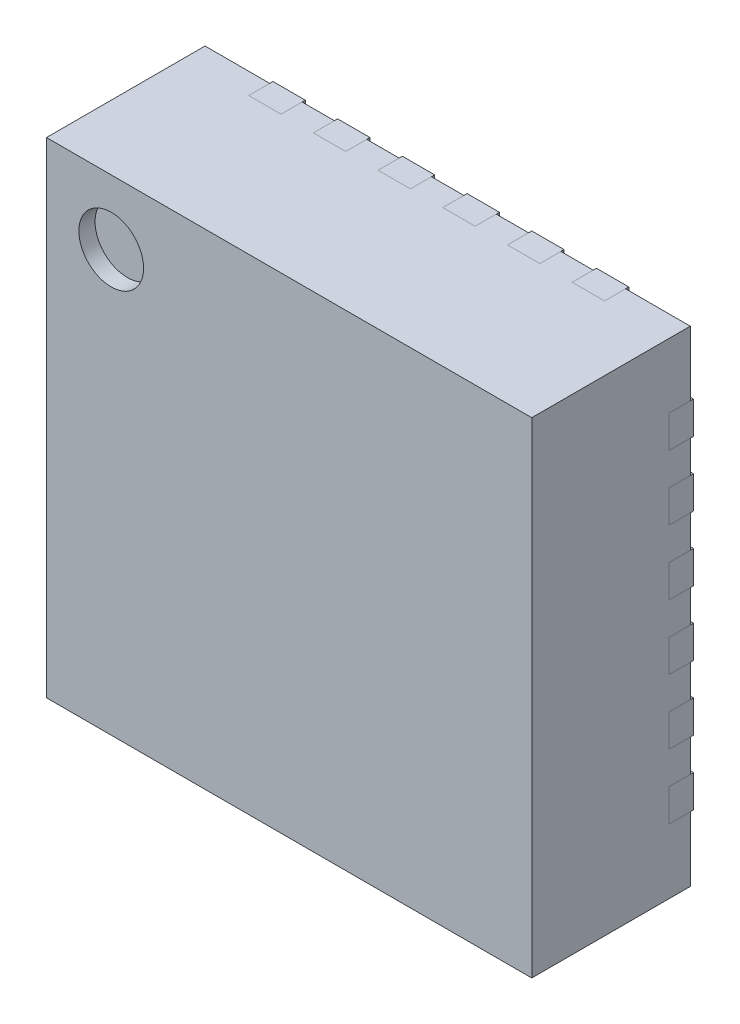
from build123d import *

# Parameters (mm, degrees)
ESQUISSE1_W                = 3
ESQUISSE1_H                = 3
BOSS_EXTRU_1_DEPTH         = 0.98
ENL_V_MAT_EXTRU_3_DEPTH    = 0.13
BOSS_EXTRU_3_DEPTH         = 0.13
BOSS_EXTRU_3_DEPTH_BACK    = 0.02
BOSS_EXTRU_3_2_DEPTH       = 0.13
BOSS_EXTRU_3_2_DEPTH_BACK  = 0.02
BOSS_EXTRU_3_3_DEPTH       = 0.13
BOSS_EXTRU_3_3_DEPTH_BACK  = 0.02
BOSS_EXTRU_3_4_DEPTH       = 0.13
BOSS_EXTRU_3_4_DEPTH_BACK  = 0.02
BOSS_EXTRU_3_5_DEPTH       = 0.13
BOSS_EXTRU_3_5_DEPTH_BACK  = 0.02
BOSS_EXTRU_3_6_DEPTH       = 0.13
BOSS_EXTRU_3_6_DEPTH_BACK  = 0.02
BOSS_EXTRU_3_7_DEPTH       = 0.13
BOSS_EXTRU_3_7_DEPTH_BACK  = 0.02
BOSS_EXTRU_3_8_DEPTH       = 0.13
BOSS_EXTRU_3_8_DEPTH_BACK  = 0.02
BOSS_EXTRU_3_9_DEPTH       = 0.13
BOSS_EXTRU_3_9_DEPTH_BACK  = 0.02
BOSS_EXTRU_3_10_DEPTH      = 0.13
BOSS_EXTRU_3_10_DEPTH_BACK = 0.02
BOSS_EXTRU_3_11_DEPTH      = 0.13
BOSS_EXTRU_3_11_DEPTH_BACK = 0.02
BOSS_EXTRU_3_12_DEPTH      = 0.13
BOSS_EXTRU_3_12_DEPTH_BACK = 0.02
BOSS_EXTRU_3_13_DEPTH      = 0.13
BOSS_EXTRU_3_13_DEPTH_BACK = 0.02
BOSS_EXTRU_3_14_DEPTH      = 0.13
BOSS_EXTRU_3_14_DEPTH_BACK = 0.02
BOSS_EXTRU_3_15_DEPTH      = 0.13
BOSS_EXTRU_3_15_DEPTH_BACK = 0.02
BOSS_EXTRU_3_16_DEPTH      = 0.13
BOSS_EXTRU_3_16_DEPTH_BACK = 0.02
BOSS_EXTRU_3_17_DEPTH      = 0.13
BOSS_EXTRU_3_17_DEPTH_BACK = 0.02
BOSS_EXTRU_3_18_DEPTH      = 0.13
BOSS_EXTRU_3_18_DEPTH_BACK = 0.02
BOSS_EXTRU_3_19_DEPTH      = 0.13
BOSS_EXTRU_3_19_DEPTH_BACK = 0.02
BOSS_EXTRU_3_20_DEPTH      = 0.13
BOSS_EXTRU_3_20_DEPTH_BACK = 0.02
BOSS_EXTRU_3_21_DEPTH      = 0.13
BOSS_EXTRU_3_21_DEPTH_BACK = 0.02
BOSS_EXTRU_3_22_DEPTH      = 0.13
BOSS_EXTRU_3_22_DEPTH_BACK = 0.02
BOSS_EXTRU_3_23_DEPTH      = 0.13
BOSS_EXTRU_3_23_DEPTH_BACK = 0.02
BOSS_EXTRU_3_24_DEPTH      = 0.13
BOSS_EXTRU_3_24_DEPTH_BACK = 0.02
BOSS_EXTRU_3_25_DEPTH      = 0.13
BOSS_EXTRU_3_25_DEPTH_BACK = 0.02
ESQUISSE5_R                = 0.2
ENL_V_MAT_EXTRU_4_DEPTH    = 0.1


with BuildPart() as part:
    # Esquisse1 → Boss.-Extru.1 (new body)
    with BuildSketch(Plane.XY):
        Rectangle(ESQUISSE1_W, ESQUISSE1_H)
    extrude(amount=BOSS_EXTRU_1_DEPTH)

    # Esquisse3 → Enlèv. mat.-Extru.3 (cut)
    with BuildSketch(Plane.XY):
        with BuildLine():
            Line((-1.275, -0.5), (-1.5, -0.5))
            Line((-1.5, -0.5), (-1.5, -0.7))
            Line((-1.5, -0.7), (-1.275, -0.7))
            ThreePointArc((-1.275, -0.7), (-1.221966991, -0.678033009), (-1.2, -0.625))
            Line((-1.2, -0.625), (-1.2, -0.575))
            ThreePointArc((-1.2, -0.575), (-1.221966991, -0.521966991), (-1.275, -0.5))
        make_face()
        with BuildLine():
            Line((0.85, 0.62), (0.85, -0.62))
            ThreePointArc((0.85, -0.62), (0.806066017, -0.726066017), (0.7, -0.77))
            Line((0.7, -0.77), (-0.7, -0.77))
            ThreePointArc((-0.7, -0.77), (-0.806066017, -0.726066017), (-0.85, -0.62))
            Line((-0.85, -0.62), (-0.85, 0.52))
            Line((-0.85, 0.52), (-0.6, 0.77))
            Line((-0.6, 0.77), (0.7, 0.77))
            ThreePointArc((0.7, 0.77), (0.806066017, 0.726066017), (0.85, 0.62))
        make_face()
        with BuildLine():
            Line((-1.5, 1.1), (-1.28, 1.1))
            ThreePointArc((-1.28, 1.1), (-1.220323996, 1.053117336), (-1.2, 0.98))
            ThreePointArc((-1.2, 0.98), (-1.223431458, 0.923431458), (-1.28, 0.9))
            Line((-1.28, 0.9), (-1.5, 0.9))
            Line((-1.5, 0.9), (-1.5, 1.1))
        make_face()
        with BuildLine():
            Line((-1.5, -0.1), (-1.5, -0.3))
            Line((-1.5, -0.3), (-1.275, -0.3))
            ThreePointArc((-1.275, -0.3), (-1.221966991, -0.278033009), (-1.2, -0.225))
            Line((-1.2, -0.225), (-1.2, -0.175))
            ThreePointArc((-1.2, -0.175), (-1.221966991, -0.121966991), (-1.275, -0.1))
            Line((-1.275, -0.1), (-1.5, -0.1))
        make_face()
        with BuildLine():
            Line((-1.5, 0.3), (-1.5, 0.1))
            Line((-1.5, 0.1), (-1.275, 0.1))
            ThreePointArc((-1.275, 0.1), (-1.221966991, 0.121966991), (-1.2, 0.175))
            Line((-1.2, 0.175), (-1.2, 0.225))
            ThreePointArc((-1.2, 0.225), (-1.221966991, 0.278033009), (-1.275, 0.3))
            Line((-1.275, 0.3), (-1.5, 0.3))
        make_face()
        with BuildLine():
            Line((-1.5, 0.7), (-1.5, 0.5))
            Line((-1.5, 0.5), (-1.275, 0.5))
            ThreePointArc((-1.275, 0.5), (-1.221966991, 0.521966991), (-1.2, 0.575))
            Line((-1.2, 0.575), (-1.2, 0.625))
            ThreePointArc((-1.2, 0.625), (-1.221966991, 0.678033009), (-1.275, 0.7))
            Line((-1.275, 0.7), (-1.5, 0.7))
        make_face()
        with BuildLine():
            Line((-1.5, -0.9), (-1.5, -1.1))
            Line((-1.5, -1.1), (-1.28, -1.1))
            ThreePointArc((-1.28, -1.1), (-1.220323996, -1.053117336), (-1.2, -0.98))
            ThreePointArc((-1.2, -0.98), (-1.223431458, -0.923431458), (-1.28, -0.9))
            Line((-1.28, -0.9), (-1.5, -0.9))
        make_face()
        with BuildLine():
            Line((1.1, 1.5), (1.1, 1.28))
            ThreePointArc((1.1, 1.28), (1.053117336, 1.220323996), (0.98, 1.2))
            ThreePointArc((0.98, 1.2), (0.923431458, 1.223431458), (0.9, 1.28))
            Line((0.9, 1.28), (0.9, 1.5))
            Line((0.9, 1.5), (1.1, 1.5))
        make_face()
        with BuildLine():
            Line((0.7, 1.5), (0.5, 1.5))
            Line((0.5, 1.5), (0.5, 1.275))
            ThreePointArc((0.5, 1.275), (0.521966991, 1.221966991), (0.575, 1.2))
            Line((0.575, 1.2), (0.625, 1.2))
            ThreePointArc((0.625, 1.2), (0.678033009, 1.221966991), (0.7, 1.275))
            Line((0.7, 1.275), (0.7, 1.5))
        make_face()
        with BuildLine():
            Line((0.3, 1.5), (0.1, 1.5))
            Line((0.1, 1.5), (0.1, 1.275))
            ThreePointArc((0.1, 1.275), (0.121966991, 1.221966991), (0.175, 1.2))
            Line((0.175, 1.2), (0.225, 1.2))
            ThreePointArc((0.225, 1.2), (0.278033009, 1.221966991), (0.3, 1.275))
            Line((0.3, 1.275), (0.3, 1.5))
        make_face()
        with BuildLine():
            Line((-0.1, 1.5), (-0.3, 1.5))
            Line((-0.3, 1.5), (-0.3, 1.275))
            ThreePointArc((-0.3, 1.275), (-0.278033009, 1.221966991), (-0.225, 1.2))
            Line((-0.225, 1.2), (-0.175, 1.2))
            ThreePointArc((-0.175, 1.2), (-0.121966991, 1.221966991), (-0.1, 1.275))
            Line((-0.1, 1.275), (-0.1, 1.5))
        make_face()
        with BuildLine():
            Line((1.5, -1.1), (1.28, -1.1))
            ThreePointArc((1.28, -1.1), (1.220323996, -1.053117336), (1.2, -0.98))
            ThreePointArc((1.2, -0.98), (1.223431458, -0.923431458), (1.28, -0.9))
            Line((1.28, -0.9), (1.5, -0.9))
            Line((1.5, -0.9), (1.5, -1.1))
        make_face()
        with BuildLine():
            Line((1.5, -0.7), (1.5, -0.5))
            Line((1.5, -0.5), (1.275, -0.5))
            ThreePointArc((1.275, -0.5), (1.221966991, -0.521966991), (1.2, -0.575))
            Line((1.2, -0.575), (1.2, -0.625))
            ThreePointArc((1.2, -0.625), (1.221966991, -0.678033009), (1.275, -0.7))
            Line((1.275, -0.7), (1.5, -0.7))
        make_face()
        with BuildLine():
            Line((1.5, -0.3), (1.5, -0.1))
            Line((1.5, -0.1), (1.275, -0.1))
            ThreePointArc((1.275, -0.1), (1.221966991, -0.121966991), (1.2, -0.175))
            Line((1.2, -0.175), (1.2, -0.225))
            ThreePointArc((1.2, -0.225), (1.221966991, -0.278033009), (1.275, -0.3))
            Line((1.275, -0.3), (1.5, -0.3))
        make_face()
        with BuildLine():
            Line((1.5, 0.1), (1.5, 0.3))
            Line((1.5, 0.3), (1.275, 0.3))
            ThreePointArc((1.275, 0.3), (1.221966991, 0.278033009), (1.2, 0.225))
            Line((1.2, 0.225), (1.2, 0.175))
            ThreePointArc((1.2, 0.175), (1.221966991, 0.121966991), (1.275, 0.1))
            Line((1.275, 0.1), (1.5, 0.1))
        make_face()
        with BuildLine():
            Line((-1.1, -1.5), (-1.1, -1.28))
            ThreePointArc((-1.1, -1.28), (-1.053117336, -1.220323996), (-0.98, -1.2))
            ThreePointArc((-0.98, -1.2), (-0.923431458, -1.223431458), (-0.9, -1.28))
            Line((-0.9, -1.28), (-0.9, -1.5))
            Line((-0.9, -1.5), (-1.1, -1.5))
        make_face()
        with BuildLine():
            Line((-0.7, -1.5), (-0.5, -1.5))
            Line((-0.5, -1.5), (-0.5, -1.275))
            ThreePointArc((-0.5, -1.275), (-0.521966991, -1.221966991), (-0.575, -1.2))
            Line((-0.575, -1.2), (-0.625, -1.2))
            ThreePointArc((-0.625, -1.2), (-0.678033009, -1.221966991), (-0.7, -1.275))
            Line((-0.7, -1.275), (-0.7, -1.5))
        make_face()
        with BuildLine():
            Line((-0.3, -1.5), (-0.1, -1.5))
            Line((-0.1, -1.5), (-0.1, -1.275))
            ThreePointArc((-0.1, -1.275), (-0.121966991, -1.221966991), (-0.175, -1.2))
            Line((-0.175, -1.2), (-0.225, -1.2))
            ThreePointArc((-0.225, -1.2), (-0.278033009, -1.221966991), (-0.3, -1.275))
            Line((-0.3, -1.275), (-0.3, -1.5))
        make_face()
        with BuildLine():
            Line((0.1, -1.5), (0.3, -1.5))
            Line((0.3, -1.5), (0.3, -1.275))
            ThreePointArc((0.3, -1.275), (0.278033009, -1.221966991), (0.225, -1.2))
            Line((0.225, -1.2), (0.175, -1.2))
            ThreePointArc((0.175, -1.2), (0.121966991, -1.221966991), (0.1, -1.275))
            Line((0.1, -1.275), (0.1, -1.5))
        make_face()
        with BuildLine():
            Line((-0.5, 1.5), (-0.7, 1.5))
            Line((-0.7, 1.5), (-0.7, 1.275))
            ThreePointArc((-0.7, 1.275), (-0.678033009, 1.221966991), (-0.625, 1.2))
            Line((-0.625, 1.2), (-0.575, 1.2))
            ThreePointArc((-0.575, 1.2), (-0.521966991, 1.221966991), (-0.5, 1.275))
            Line((-0.5, 1.275), (-0.5, 1.5))
        make_face()
        with BuildLine():
            Line((-0.9, 1.5), (-1.1, 1.5))
            Line((-1.1, 1.5), (-1.1, 1.28))
            ThreePointArc((-1.1, 1.28), (-1.053117336, 1.220323996), (-0.98, 1.2))
            ThreePointArc((-0.98, 1.2), (-0.923431458, 1.223431458), (-0.9, 1.28))
            Line((-0.9, 1.28), (-0.9, 1.5))
        make_face()
        with BuildLine():
            Line((1.5, 0.5), (1.5, 0.7))
            Line((1.5, 0.7), (1.275, 0.7))
            ThreePointArc((1.275, 0.7), (1.221966991, 0.678033009), (1.2, 0.625))
            Line((1.2, 0.625), (1.2, 0.575))
            ThreePointArc((1.2, 0.575), (1.221966991, 0.521966991), (1.275, 0.5))
            Line((1.275, 0.5), (1.5, 0.5))
        make_face()
        with BuildLine():
            Line((1.5, 0.9), (1.5, 1.1))
            Line((1.5, 1.1), (1.28, 1.1))
            ThreePointArc((1.28, 1.1), (1.220323996, 1.053117336), (1.2, 0.98))
            ThreePointArc((1.2, 0.98), (1.223431458, 0.923431458), (1.28, 0.9))
            Line((1.28, 0.9), (1.5, 0.9))
        make_face()
        with BuildLine():
            Line((0.5, -1.5), (0.7, -1.5))
            Line((0.7, -1.5), (0.7, -1.275))
            ThreePointArc((0.7, -1.275), (0.678033009, -1.221966991), (0.625, -1.2))
            Line((0.625, -1.2), (0.575, -1.2))
            ThreePointArc((0.575, -1.2), (0.521966991, -1.221966991), (0.5, -1.275))
            Line((0.5, -1.275), (0.5, -1.5))
        make_face()
        with BuildLine():
            Line((0.9, -1.5), (1.1, -1.5))
            Line((1.1, -1.5), (1.1, -1.28))
            ThreePointArc((1.1, -1.28), (1.053117336, -1.220323996), (0.98, -1.2))
            ThreePointArc((0.98, -1.2), (0.923431458, -1.223431458), (0.9, -1.28))
            Line((0.9, -1.28), (0.9, -1.5))
        make_face()
    extrude(amount=ENL_V_MAT_EXTRU_3_DEPTH, mode=Mode.SUBTRACT)

    # Esquisse5 → Enlèv. mat.-Extru.4 (cut)
    with BuildSketch(Plane.XY.offset(0.98)):
        with Locations((-1.1, 1.1)):
            Circle(ESQUISSE5_R)
    extrude(amount=-ENL_V_MAT_EXTRU_4_DEPTH, mode=Mode.SUBTRACT)


with BuildPart() as body_2:
    # Esquisse4 → Boss.-Extru.3 (new, two sides: drawn at the far end of the back side and taken through both)
    with BuildSketch(Plane.XY.offset(-BOSS_EXTRU_3_DEPTH_BACK)):
        with BuildLine():
            Line((-1.275, -0.5), (-1.5, -0.5))
            Line((-1.5, -0.5), (-1.5, -0.7))
            Line((-1.5, -0.7), (-1.275, -0.7))
            ThreePointArc((-1.275, -0.7), (-1.221966991, -0.678033009), (-1.2, -0.625))
            Line((-1.2, -0.625), (-1.2, -0.575))
            ThreePointArc((-1.2, -0.575), (-1.221966991, -0.521966991), (-1.275, -0.5))
        make_face()
    extrude(amount=BOSS_EXTRU_3_DEPTH + BOSS_EXTRU_3_DEPTH_BACK)


with BuildPart() as body_3:
    # Esquisse4 → Boss.-Extru.3 2 (new, two sides: drawn at the far end of the back side and taken through both)
    with BuildSketch(Plane.XY.offset(-BOSS_EXTRU_3_2_DEPTH_BACK)):
        with BuildLine():
            Line((0.85, 0.62), (0.85, -0.62))
            ThreePointArc((0.85, -0.62), (0.806066017, -0.726066017), (0.7, -0.77))
            Line((0.7, -0.77), (-0.7, -0.77))
            ThreePointArc((-0.7, -0.77), (-0.806066017, -0.726066017), (-0.85, -0.62))
            Line((-0.85, -0.62), (-0.85, 0.52))
            Line((-0.85, 0.52), (-0.6, 0.77))
            Line((-0.6, 0.77), (0.7, 0.77))
            ThreePointArc((0.7, 0.77), (0.806066017, 0.726066017), (0.85, 0.62))
        make_face()
    extrude(amount=BOSS_EXTRU_3_2_DEPTH + BOSS_EXTRU_3_2_DEPTH_BACK)


with BuildPart() as body_4:
    # Esquisse4 → Boss.-Extru.3 3 (new, two sides: drawn at the far end of the back side and taken through both)
    with BuildSketch(Plane.XY.offset(-BOSS_EXTRU_3_3_DEPTH_BACK)):
        with BuildLine():
            Line((-1.5, 1.1), (-1.28, 1.1))
            ThreePointArc((-1.28, 1.1), (-1.220323996, 1.053117336), (-1.2, 0.98))
            ThreePointArc((-1.2, 0.98), (-1.223431458, 0.923431458), (-1.28, 0.9))
            Line((-1.28, 0.9), (-1.5, 0.9))
            Line((-1.5, 0.9), (-1.5, 1.1))
        make_face()
    extrude(amount=BOSS_EXTRU_3_3_DEPTH + BOSS_EXTRU_3_3_DEPTH_BACK)


with BuildPart() as body_5:
    # Esquisse4 → Boss.-Extru.3 4 (new, two sides: drawn at the far end of the back side and taken through both)
    with BuildSketch(Plane.XY.offset(-BOSS_EXTRU_3_4_DEPTH_BACK)):
        with BuildLine():
            Line((-1.5, -0.1), (-1.5, -0.3))
            Line((-1.5, -0.3), (-1.275, -0.3))
            ThreePointArc((-1.275, -0.3), (-1.221966991, -0.278033009), (-1.2, -0.225))
            Line((-1.2, -0.225), (-1.2, -0.175))
            ThreePointArc((-1.2, -0.175), (-1.221966991, -0.121966991), (-1.275, -0.1))
            Line((-1.275, -0.1), (-1.5, -0.1))
        make_face()
    extrude(amount=BOSS_EXTRU_3_4_DEPTH + BOSS_EXTRU_3_4_DEPTH_BACK)


with BuildPart() as body_6:
    # Esquisse4 → Boss.-Extru.3 5 (new, two sides: drawn at the far end of the back side and taken through both)
    with BuildSketch(Plane.XY.offset(-BOSS_EXTRU_3_5_DEPTH_BACK)):
        with BuildLine():
            Line((-1.5, 0.3), (-1.5, 0.1))
            Line((-1.5, 0.1), (-1.275, 0.1))
            ThreePointArc((-1.275, 0.1), (-1.221966991, 0.121966991), (-1.2, 0.175))
            Line((-1.2, 0.175), (-1.2, 0.225))
            ThreePointArc((-1.2, 0.225), (-1.221966991, 0.278033009), (-1.275, 0.3))
            Line((-1.275, 0.3), (-1.5, 0.3))
        make_face()
    extrude(amount=BOSS_EXTRU_3_5_DEPTH + BOSS_EXTRU_3_5_DEPTH_BACK)


with BuildPart() as body_7:
    # Esquisse4 → Boss.-Extru.3 6 (new, two sides: drawn at the far end of the back side and taken through both)
    with BuildSketch(Plane.XY.offset(-BOSS_EXTRU_3_6_DEPTH_BACK)):
        with BuildLine():
            Line((-1.5, 0.7), (-1.5, 0.5))
            Line((-1.5, 0.5), (-1.275, 0.5))
            ThreePointArc((-1.275, 0.5), (-1.221966991, 0.521966991), (-1.2, 0.575))
            Line((-1.2, 0.575), (-1.2, 0.625))
            ThreePointArc((-1.2, 0.625), (-1.221966991, 0.678033009), (-1.275, 0.7))
            Line((-1.275, 0.7), (-1.5, 0.7))
        make_face()
    extrude(amount=BOSS_EXTRU_3_6_DEPTH + BOSS_EXTRU_3_6_DEPTH_BACK)


with BuildPart() as body_8:
    # Esquisse4 → Boss.-Extru.3 7 (new, two sides: drawn at the far end of the back side and taken through both)
    with BuildSketch(Plane.XY.offset(-BOSS_EXTRU_3_7_DEPTH_BACK)):
        with BuildLine():
            Line((-1.5, -0.9), (-1.5, -1.1))
            Line((-1.5, -1.1), (-1.28, -1.1))
            ThreePointArc((-1.28, -1.1), (-1.220323996, -1.053117336), (-1.2, -0.98))
            ThreePointArc((-1.2, -0.98), (-1.223431458, -0.923431458), (-1.28, -0.9))
            Line((-1.28, -0.9), (-1.5, -0.9))
        make_face()
    extrude(amount=BOSS_EXTRU_3_7_DEPTH + BOSS_EXTRU_3_7_DEPTH_BACK)


with BuildPart() as body_9:
    # Esquisse4 → Boss.-Extru.3 8 (new, two sides: drawn at the far end of the back side and taken through both)
    with BuildSketch(Plane.XY.offset(-BOSS_EXTRU_3_8_DEPTH_BACK)):
        with BuildLine():
            Line((1.1, 1.5), (1.1, 1.28))
            ThreePointArc((1.1, 1.28), (1.053117336, 1.220323996), (0.98, 1.2))
            ThreePointArc((0.98, 1.2), (0.923431458, 1.223431458), (0.9, 1.28))
            Line((0.9, 1.28), (0.9, 1.5))
            Line((0.9, 1.5), (1.1, 1.5))
        make_face()
    extrude(amount=BOSS_EXTRU_3_8_DEPTH + BOSS_EXTRU_3_8_DEPTH_BACK)


with BuildPart() as body_10:
    # Esquisse4 → Boss.-Extru.3 9 (new, two sides: drawn at the far end of the back side and taken through both)
    with BuildSketch(Plane.XY.offset(-BOSS_EXTRU_3_9_DEPTH_BACK)):
        with BuildLine():
            Line((0.7, 1.5), (0.5, 1.5))
            Line((0.5, 1.5), (0.5, 1.275))
            ThreePointArc((0.5, 1.275), (0.521966991, 1.221966991), (0.575, 1.2))
            Line((0.575, 1.2), (0.625, 1.2))
            ThreePointArc((0.625, 1.2), (0.678033009, 1.221966991), (0.7, 1.275))
            Line((0.7, 1.275), (0.7, 1.5))
        make_face()
    extrude(amount=BOSS_EXTRU_3_9_DEPTH + BOSS_EXTRU_3_9_DEPTH_BACK)


with BuildPart() as body_11:
    # Esquisse4 → Boss.-Extru.3 10 (new, two sides: drawn at the far end of the back side and taken through both)
    with BuildSketch(Plane.XY.offset(-BOSS_EXTRU_3_10_DEPTH_BACK)):
        with BuildLine():
            Line((0.3, 1.5), (0.1, 1.5))
            Line((0.1, 1.5), (0.1, 1.275))
            ThreePointArc((0.1, 1.275), (0.121966991, 1.221966991), (0.175, 1.2))
            Line((0.175, 1.2), (0.225, 1.2))
            ThreePointArc((0.225, 1.2), (0.278033009, 1.221966991), (0.3, 1.275))
            Line((0.3, 1.275), (0.3, 1.5))
        make_face()
    extrude(amount=BOSS_EXTRU_3_10_DEPTH + BOSS_EXTRU_3_10_DEPTH_BACK)


with BuildPart() as body_12:
    # Esquisse4 → Boss.-Extru.3 11 (new, two sides: drawn at the far end of the back side and taken through both)
    with BuildSketch(Plane.XY.offset(-BOSS_EXTRU_3_11_DEPTH_BACK)):
        with BuildLine():
            Line((-0.1, 1.5), (-0.3, 1.5))
            Line((-0.3, 1.5), (-0.3, 1.275))
            ThreePointArc((-0.3, 1.275), (-0.278033009, 1.221966991), (-0.225, 1.2))
            Line((-0.225, 1.2), (-0.175, 1.2))
            ThreePointArc((-0.175, 1.2), (-0.121966991, 1.221966991), (-0.1, 1.275))
            Line((-0.1, 1.275), (-0.1, 1.5))
        make_face()
    extrude(amount=BOSS_EXTRU_3_11_DEPTH + BOSS_EXTRU_3_11_DEPTH_BACK)


with BuildPart() as body_13:
    # Esquisse4 → Boss.-Extru.3 12 (new, two sides: drawn at the far end of the back side and taken through both)
    with BuildSketch(Plane.XY.offset(-BOSS_EXTRU_3_12_DEPTH_BACK)):
        with BuildLine():
            Line((1.5, -1.1), (1.28, -1.1))
            ThreePointArc((1.28, -1.1), (1.220323996, -1.053117336), (1.2, -0.98))
            ThreePointArc((1.2, -0.98), (1.223431458, -0.923431458), (1.28, -0.9))
            Line((1.28, -0.9), (1.5, -0.9))
            Line((1.5, -0.9), (1.5, -1.1))
        make_face()
    extrude(amount=BOSS_EXTRU_3_12_DEPTH + BOSS_EXTRU_3_12_DEPTH_BACK)


with BuildPart() as body_14:
    # Esquisse4 → Boss.-Extru.3 13 (new, two sides: drawn at the far end of the back side and taken through both)
    with BuildSketch(Plane.XY.offset(-BOSS_EXTRU_3_13_DEPTH_BACK)):
        with BuildLine():
            Line((1.5, -0.7), (1.5, -0.5))
            Line((1.5, -0.5), (1.275, -0.5))
            ThreePointArc((1.275, -0.5), (1.221966991, -0.521966991), (1.2, -0.575))
            Line((1.2, -0.575), (1.2, -0.625))
            ThreePointArc((1.2, -0.625), (1.221966991, -0.678033009), (1.275, -0.7))
            Line((1.275, -0.7), (1.5, -0.7))
        make_face()
    extrude(amount=BOSS_EXTRU_3_13_DEPTH + BOSS_EXTRU_3_13_DEPTH_BACK)


with BuildPart() as body_15:
    # Esquisse4 → Boss.-Extru.3 14 (new, two sides: drawn at the far end of the back side and taken through both)
    with BuildSketch(Plane.XY.offset(-BOSS_EXTRU_3_14_DEPTH_BACK)):
        with BuildLine():
            Line((1.5, -0.3), (1.5, -0.1))
            Line((1.5, -0.1), (1.275, -0.1))
            ThreePointArc((1.275, -0.1), (1.221966991, -0.121966991), (1.2, -0.175))
            Line((1.2, -0.175), (1.2, -0.225))
            ThreePointArc((1.2, -0.225), (1.221966991, -0.278033009), (1.275, -0.3))
            Line((1.275, -0.3), (1.5, -0.3))
        make_face()
    extrude(amount=BOSS_EXTRU_3_14_DEPTH + BOSS_EXTRU_3_14_DEPTH_BACK)


with BuildPart() as body_16:
    # Esquisse4 → Boss.-Extru.3 15 (new, two sides: drawn at the far end of the back side and taken through both)
    with BuildSketch(Plane.XY.offset(-BOSS_EXTRU_3_15_DEPTH_BACK)):
        with BuildLine():
            Line((1.5, 0.1), (1.5, 0.3))
            Line((1.5, 0.3), (1.275, 0.3))
            ThreePointArc((1.275, 0.3), (1.221966991, 0.278033009), (1.2, 0.225))
            Line((1.2, 0.225), (1.2, 0.175))
            ThreePointArc((1.2, 0.175), (1.221966991, 0.121966991), (1.275, 0.1))
            Line((1.275, 0.1), (1.5, 0.1))
        make_face()
    extrude(amount=BOSS_EXTRU_3_15_DEPTH + BOSS_EXTRU_3_15_DEPTH_BACK)


with BuildPart() as body_17:
    # Esquisse4 → Boss.-Extru.3 16 (new, two sides: drawn at the far end of the back side and taken through both)
    with BuildSketch(Plane.XY.offset(-BOSS_EXTRU_3_16_DEPTH_BACK)):
        with BuildLine():
            Line((-1.1, -1.5), (-1.1, -1.28))
            ThreePointArc((-1.1, -1.28), (-1.053117336, -1.220323996), (-0.98, -1.2))
            ThreePointArc((-0.98, -1.2), (-0.923431458, -1.223431458), (-0.9, -1.28))
            Line((-0.9, -1.28), (-0.9, -1.5))
            Line((-0.9, -1.5), (-1.1, -1.5))
        make_face()
    extrude(amount=BOSS_EXTRU_3_16_DEPTH + BOSS_EXTRU_3_16_DEPTH_BACK)


with BuildPart() as body_18:
    # Esquisse4 → Boss.-Extru.3 17 (new, two sides: drawn at the far end of the back side and taken through both)
    with BuildSketch(Plane.XY.offset(-BOSS_EXTRU_3_17_DEPTH_BACK)):
        with BuildLine():
            Line((-0.7, -1.5), (-0.5, -1.5))
            Line((-0.5, -1.5), (-0.5, -1.275))
            ThreePointArc((-0.5, -1.275), (-0.521966991, -1.221966991), (-0.575, -1.2))
            Line((-0.575, -1.2), (-0.625, -1.2))
            ThreePointArc((-0.625, -1.2), (-0.678033009, -1.221966991), (-0.7, -1.275))
            Line((-0.7, -1.275), (-0.7, -1.5))
        make_face()
    extrude(amount=BOSS_EXTRU_3_17_DEPTH + BOSS_EXTRU_3_17_DEPTH_BACK)


with BuildPart() as body_19:
    # Esquisse4 → Boss.-Extru.3 18 (new, two sides: drawn at the far end of the back side and taken through both)
    with BuildSketch(Plane.XY.offset(-BOSS_EXTRU_3_18_DEPTH_BACK)):
        with BuildLine():
            Line((-0.3, -1.5), (-0.1, -1.5))
            Line((-0.1, -1.5), (-0.1, -1.275))
            ThreePointArc((-0.1, -1.275), (-0.121966991, -1.221966991), (-0.175, -1.2))
            Line((-0.175, -1.2), (-0.225, -1.2))
            ThreePointArc((-0.225, -1.2), (-0.278033009, -1.221966991), (-0.3, -1.275))
            Line((-0.3, -1.275), (-0.3, -1.5))
        make_face()
    extrude(amount=BOSS_EXTRU_3_18_DEPTH + BOSS_EXTRU_3_18_DEPTH_BACK)


with BuildPart() as body_20:
    # Esquisse4 → Boss.-Extru.3 19 (new, two sides: drawn at the far end of the back side and taken through both)
    with BuildSketch(Plane.XY.offset(-BOSS_EXTRU_3_19_DEPTH_BACK)):
        with BuildLine():
            Line((0.1, -1.5), (0.3, -1.5))
            Line((0.3, -1.5), (0.3, -1.275))
            ThreePointArc((0.3, -1.275), (0.278033009, -1.221966991), (0.225, -1.2))
            Line((0.225, -1.2), (0.175, -1.2))
            ThreePointArc((0.175, -1.2), (0.121966991, -1.221966991), (0.1, -1.275))
            Line((0.1, -1.275), (0.1, -1.5))
        make_face()
    extrude(amount=BOSS_EXTRU_3_19_DEPTH + BOSS_EXTRU_3_19_DEPTH_BACK)


with BuildPart() as body_21:
    # Esquisse4 → Boss.-Extru.3 20 (new, two sides: drawn at the far end of the back side and taken through both)
    with BuildSketch(Plane.XY.offset(-BOSS_EXTRU_3_20_DEPTH_BACK)):
        with BuildLine():
            Line((-0.5, 1.5), (-0.7, 1.5))
            Line((-0.7, 1.5), (-0.7, 1.275))
            ThreePointArc((-0.7, 1.275), (-0.678033009, 1.221966991), (-0.625, 1.2))
            Line((-0.625, 1.2), (-0.575, 1.2))
            ThreePointArc((-0.575, 1.2), (-0.521966991, 1.221966991), (-0.5, 1.275))
            Line((-0.5, 1.275), (-0.5, 1.5))
        make_face()
    extrude(amount=BOSS_EXTRU_3_20_DEPTH + BOSS_EXTRU_3_20_DEPTH_BACK)


with BuildPart() as body_22:
    # Esquisse4 → Boss.-Extru.3 21 (new, two sides: drawn at the far end of the back side and taken through both)
    with BuildSketch(Plane.XY.offset(-BOSS_EXTRU_3_21_DEPTH_BACK)):
        with BuildLine():
            Line((-0.9, 1.5), (-1.1, 1.5))
            Line((-1.1, 1.5), (-1.1, 1.28))
            ThreePointArc((-1.1, 1.28), (-1.053117336, 1.220323996), (-0.98, 1.2))
            ThreePointArc((-0.98, 1.2), (-0.923431458, 1.223431458), (-0.9, 1.28))
            Line((-0.9, 1.28), (-0.9, 1.5))
        make_face()
    extrude(amount=BOSS_EXTRU_3_21_DEPTH + BOSS_EXTRU_3_21_DEPTH_BACK)


with BuildPart() as body_23:
    # Esquisse4 → Boss.-Extru.3 22 (new, two sides: drawn at the far end of the back side and taken through both)
    with BuildSketch(Plane.XY.offset(-BOSS_EXTRU_3_22_DEPTH_BACK)):
        with BuildLine():
            Line((1.5, 0.5), (1.5, 0.7))
            Line((1.5, 0.7), (1.275, 0.7))
            ThreePointArc((1.275, 0.7), (1.221966991, 0.678033009), (1.2, 0.625))
            Line((1.2, 0.625), (1.2, 0.575))
            ThreePointArc((1.2, 0.575), (1.221966991, 0.521966991), (1.275, 0.5))
            Line((1.275, 0.5), (1.5, 0.5))
        make_face()
    extrude(amount=BOSS_EXTRU_3_22_DEPTH + BOSS_EXTRU_3_22_DEPTH_BACK)


with BuildPart() as body_24:
    # Esquisse4 → Boss.-Extru.3 23 (new, two sides: drawn at the far end of the back side and taken through both)
    with BuildSketch(Plane.XY.offset(-BOSS_EXTRU_3_23_DEPTH_BACK)):
        with BuildLine():
            Line((1.5, 0.9), (1.5, 1.1))
            Line((1.5, 1.1), (1.28, 1.1))
            ThreePointArc((1.28, 1.1), (1.220323996, 1.053117336), (1.2, 0.98))
            ThreePointArc((1.2, 0.98), (1.223431458, 0.923431458), (1.28, 0.9))
            Line((1.28, 0.9), (1.5, 0.9))
        make_face()
    extrude(amount=BOSS_EXTRU_3_23_DEPTH + BOSS_EXTRU_3_23_DEPTH_BACK)


with BuildPart() as body_25:
    # Esquisse4 → Boss.-Extru.3 24 (new, two sides: drawn at the far end of the back side and taken through both)
    with BuildSketch(Plane.XY.offset(-BOSS_EXTRU_3_24_DEPTH_BACK)):
        with BuildLine():
            Line((0.5, -1.5), (0.7, -1.5))
            Line((0.7, -1.5), (0.7, -1.275))
            ThreePointArc((0.7, -1.275), (0.678033009, -1.221966991), (0.625, -1.2))
            Line((0.625, -1.2), (0.575, -1.2))
            ThreePointArc((0.575, -1.2), (0.521966991, -1.221966991), (0.5, -1.275))
            Line((0.5, -1.275), (0.5, -1.5))
        make_face()
    extrude(amount=BOSS_EXTRU_3_24_DEPTH + BOSS_EXTRU_3_24_DEPTH_BACK)


with BuildPart() as body_26:
    # Esquisse4 → Boss.-Extru.3 25 (new, two sides: drawn at the far end of the back side and taken through both)
    with BuildSketch(Plane.XY.offset(-BOSS_EXTRU_3_25_DEPTH_BACK)):
        with BuildLine():
            Line((0.9, -1.5), (1.1, -1.5))
            Line((1.1, -1.5), (1.1, -1.28))
            ThreePointArc((1.1, -1.28), (1.053117336, -1.220323996), (0.98, -1.2))
            ThreePointArc((0.98, -1.2), (0.923431458, -1.223431458), (0.9, -1.28))
            Line((0.9, -1.28), (0.9, -1.5))
        make_face()
    extrude(amount=BOSS_EXTRU_3_25_DEPTH + BOSS_EXTRU_3_25_DEPTH_BACK)


solid = Compound([part.part, body_2.part, body_3.part, body_4.part, body_5.part, body_6.part, body_7.part, body_8.part, body_9.part, body_10.part, body_11.part, body_12.part, body_13.part, body_14.part, body_15.part, body_16.part, body_17.part, body_18.part, body_19.part, body_20.part, body_21.part, body_22.part, body_23.part, body_24.part, body_25.part, body_26.part])
